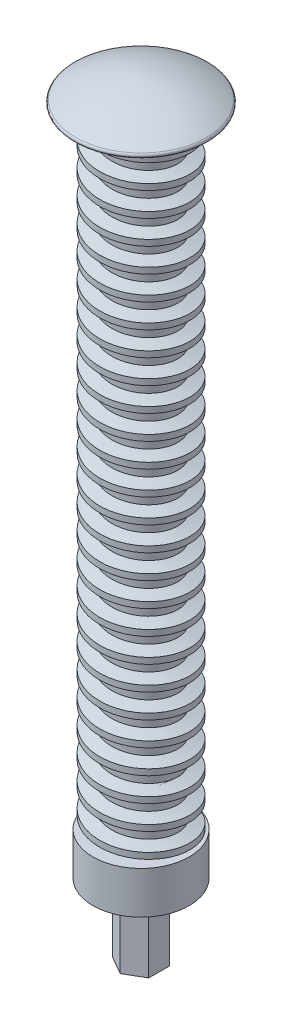
from build123d import *

# Parameters (mm, degrees)
SKETCH1_R           = 2.75
BOSS_EXTRUDE1_DEPTH = 52
SWEEP1_PITCH        = 2
BOSS_EXTRUDE2_START = -52
SKETCH1_3_R         = 3.99
BOSS_EXTRUDE2_DEPTH = 3.5
BOSS_EXTRUDE3_START = -55.5
BOSS_EXTRUDE3_DEPTH = 6
SKETCH7_R           = 0.5
CUT_EXTRUDE1_DEPTH  = 4.5
FILLET1_R           = 0.2


with BuildPart() as part:
    # Sketch3 → Revolve1 (revolve)
    with BuildSketch(Plane.XY):
        with BuildLine():
            Line((0, 0), (0, 2))
            ThreePointArc((0, 2), (3.147262239, 1.420334935), (6.015, 0))
            Line((6.015, 0), (0, 0))
        make_face()
    revolve(axis=Axis((0, 0, 0), (0, 1, 0)))

    # Sketch1 → Boss-Extrude1 (add)
    with BuildSketch(Plane(origin=(0, 0, 0), x_dir=(1, 0, 0), z_dir=(0, 1, 0))):
        with Locations(Location((0, 0, 0), (0, 0, 270))):
            Circle(SKETCH1_R)
    extrude(amount=-BOSS_EXTRUDE1_DEPTH)

    # Sweep1: arcs per turn and ends read off the stored shape
    # Sweep1: the profile of Sketch4 profile screwed along a left-hand helix through 26 turns, 10 arcs to a turn; built about Z, then put on its axis
    sweep1_z = Axis((0, 0, 0), (0, 0, 1))
    sweep1_corners = [(3.75, 0, 0.25), (2.7497, 0, -7.5e-05), (2.7497, 0, 1.000075), (3.75, 0, 0.75)]
    with BuildLine(mode=Mode.PRIVATE) as sweep1_profile:
        Line(sweep1_corners[0], sweep1_corners[1])
        Line(sweep1_corners[1], sweep1_corners[2])
        Line(sweep1_corners[2], sweep1_corners[3])
        Line(sweep1_corners[3], sweep1_corners[0])
    sweep1_cap = Face(sweep1_profile.wire())
    sweep1_turn_angles = [0, -18, -36, -54, -72, -90, -108, -126, -144, -162, -180, -198, -216, -234, -252, -270, -288, -306, -324, -342, -360]
    sweep1_turn_weights = [1, 0.9510565162951535, 1, 0.9510565162951535, 1, 0.9510565162951535, 1, 0.9510565162951535, 1, 0.9510565162951535, 1, 0.9510565162951535, 1, 0.9510565162951535, 1, 0.9510565162951535, 1, 0.9510565162951535, 1, 0.9510565162951535, 1]
    sweep1_turn_rails = [Edge.make_bspline([Vector(p[0], p[1], 0).rotate(sweep1_z, sweep1_turn_angles[k]) / sweep1_turn_weights[k] + Vector(0, 0, p[2] + -SWEEP1_PITCH * sweep1_turn_angles[k] / 360) for k in range(21)], [0, 0, 0, 1, 1, 2, 2, 3, 3, 4, 4, 5, 5, 6, 6, 7, 7, 8, 8, 9, 9, 10, 10, 10], 2, sweep1_turn_weights) for p in sweep1_corners]
    sweep1_turn_sides = [Face.make_surface_from_curves(sweep1_turn_rails[p[0]], sweep1_turn_rails[p[1]]) for p in [(0, 1), (1, 2), (2, 3), (3, 0)]]
    sweep1 = Plane(origin=(0, 0, 0), x_dir=(-1, 0, 0), z_dir=(0, -1, 0)) * Solid(Shell([*[p.moved(Location((0, 0, SWEEP1_PITCH * i))) for i in range(26) for p in sweep1_turn_sides], sweep1_cap, sweep1_cap.rotate(sweep1_z, -9360).moved(Location((0, 0, -SWEEP1_PITCH * -9360 / 360)))]))
    add(sweep1)

    # Sketch1<3> → Boss-Extrude2 (add)
    with BuildSketch(Plane(origin=(0, 0, 0), x_dir=(1, 0, 0), z_dir=(0, 1, 0)).offset(BOSS_EXTRUDE2_START)):
        with Locations(Location((0, 0, 0), (0, 0, 270))):
            Circle(SKETCH1_3_R)
    extrude(amount=-BOSS_EXTRUDE2_DEPTH)

    # Sketch1<4> → Boss-Extrude3 (add)
    with BuildSketch(Plane(origin=(0, 0, 0), x_dir=(1, 0, 0), z_dir=(0, 1, 0)).offset(BOSS_EXTRUDE3_START)):
        Polygon((0, -1.732050808), (1.5, -0.866025404), (1.5, 0.866025404), (0, 1.732050808), (-1.5, 0.866025404), (-1.5, -0.866025404), align=None)
    extrude(amount=-BOSS_EXTRUDE3_DEPTH)

    # Sketch7 → Cut-Extrude1 (cut)
    with BuildSketch(Plane.XZ.offset(61.5)):
        with Locations(Location((0, 0, 0), (0, 0, 270))):
            Circle(SKETCH7_R)
    extrude(amount=-CUT_EXTRUDE1_DEPTH, mode=Mode.SUBTRACT)

    # Fillet1
    fillet1_edges = [part.edges().sort_by_distance(p)[0] for p in [
        (-6.015, 0, 0),
    ]]
    fillet(fillet1_edges, radius=FILLET1_R)


solid = part.part
